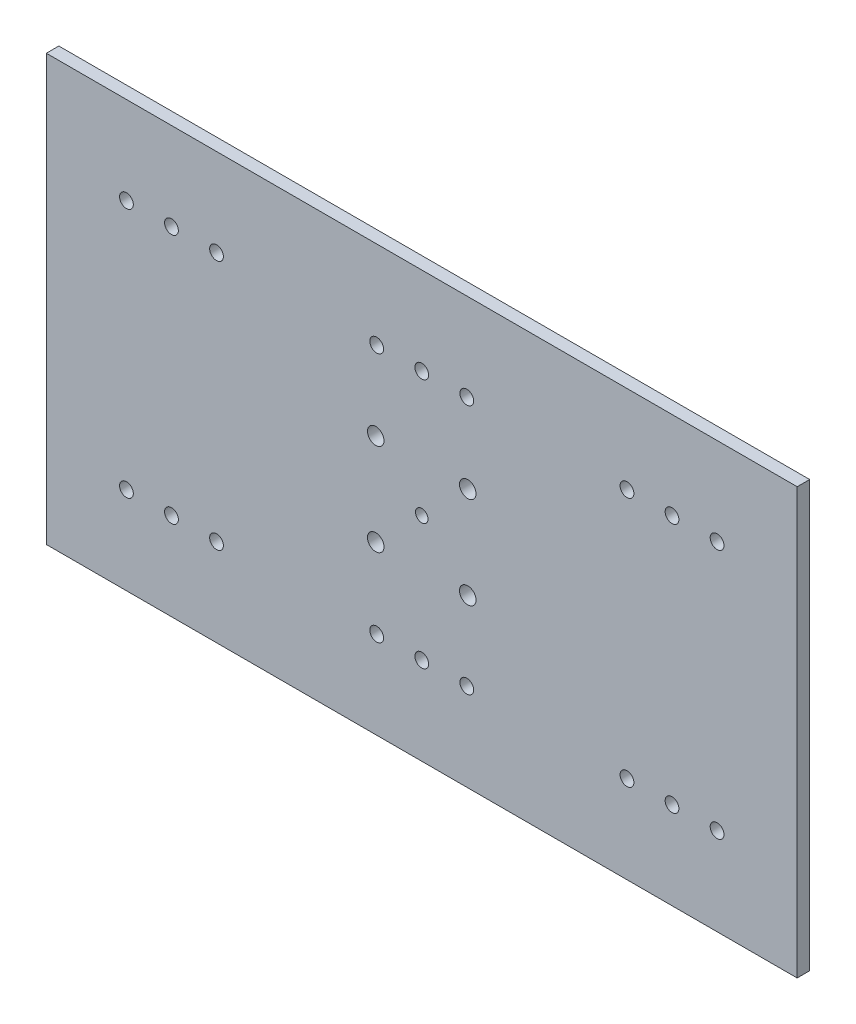
from build123d import *

# Parameters (mm, degrees)
SKETCH_1_W          = 300
SKETCH_1_H          = 250
SKETCH_1_R          = 3.3
SKETCH_1_R_2        = 2.5
EXTRUDE_1_DEPTH     = 5
SKETCH_2_R          = 2.75
CUT_EXTRUDE_1_DEPTH = 196.320249846
SKETCH_3_W          = 300
SKETCH_3_H          = 40
CUT_EXTRUDE_2_DEPTH = 196.320249846


with BuildPart() as part:
    # 草图1 → 凸台-拉伸1 (new body)
    with BuildSketch(Plane.XY):
        Rectangle(SKETCH_1_W, SKETCH_1_H)
        with Locations((-18.384776311, 18.384776311)):
            Circle(SKETCH_1_R, mode=Mode.SUBTRACT)
        with Locations((18.384776311, 18.384776311)):
            Circle(SKETCH_1_R, mode=Mode.SUBTRACT)
        with Locations((18.384776311, -18.384776311)):
            Circle(SKETCH_1_R, mode=Mode.SUBTRACT)
        with Locations((-18.384776311, -18.384776311)):
            Circle(SKETCH_1_R, mode=Mode.SUBTRACT)
        Circle(SKETCH_1_R_2, mode=Mode.SUBTRACT)
    extrude(amount=EXTRUDE_1_DEPTH)

    # 草图2 → 切除-拉伸1 (cut, through all)
    with BuildSketch(Plane.XY.offset(5)):
        with Locations((-100, 50)):
            Circle(SKETCH_2_R)
        with Locations((0, 50)):
            Circle(SKETCH_2_R)
        with Locations((100, 50)):
            Circle(SKETCH_2_R)
        with Locations((100, -50)):
            Circle(SKETCH_2_R)
        with Locations((0, -50)):
            Circle(SKETCH_2_R)
        with Locations((-100, -50)):
            Circle(SKETCH_2_R)
        with Locations((-118, 50)):
            Circle(SKETCH_2_R)
        with Locations((-82, 50)):
            Circle(SKETCH_2_R)
        with Locations((-82, -50)):
            Circle(SKETCH_2_R)
        with Locations((-118, -50)):
            Circle(SKETCH_2_R)
        with Locations((-18, 50)):
            Circle(SKETCH_2_R)
        with Locations((-18, -50)):
            Circle(SKETCH_2_R)
        with Locations((118, -50)):
            Circle(SKETCH_2_R)
        with Locations((82, -50)):
            Circle(SKETCH_2_R)
        with Locations((18, -50)):
            Circle(SKETCH_2_R)
        with Locations((18, 50)):
            Circle(SKETCH_2_R)
        with Locations((82, 50)):
            Circle(SKETCH_2_R)
        with Locations((118, 50)):
            Circle(SKETCH_2_R)
    extrude(amount=-CUT_EXTRUDE_1_DEPTH, mode=Mode.SUBTRACT)

    # 草图3 → 切除-拉伸2 (cut, through all)
    with BuildSketch(Plane.XY.offset(5)):
        with Locations((0, 105)):
            Rectangle(SKETCH_3_W, SKETCH_3_H)
        with Locations((0, -105)):
            Rectangle(SKETCH_3_W, SKETCH_3_H)
    extrude(amount=-CUT_EXTRUDE_2_DEPTH, mode=Mode.SUBTRACT)


solid = part.part
